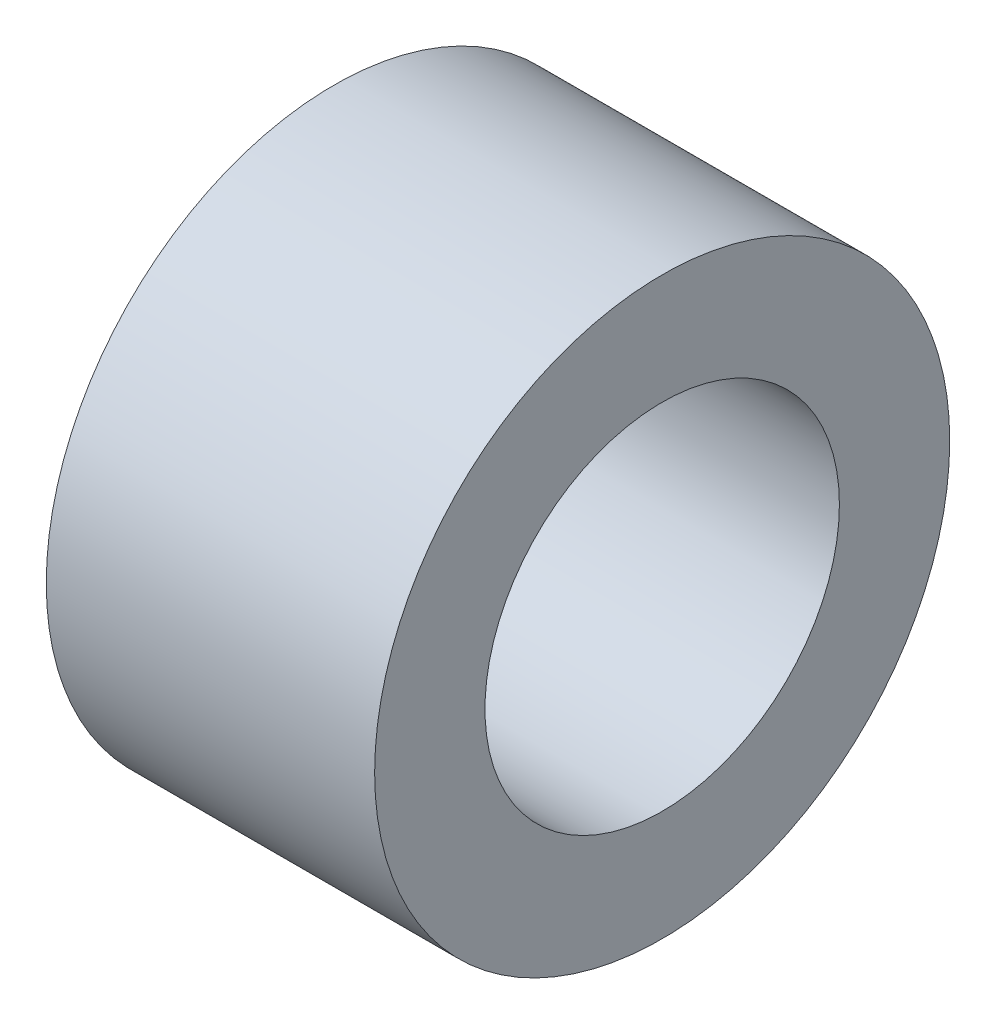
from build123d import *

# Parameters (mm, degrees)
SKETCH1_R           = 11.901099896
SKETCH1_R_2         = 10.2
BOSS_EXTRUDE1_DEPTH = 1.000000032
SKETCH2_R           = 16.55
SKETCH2_R_2         = 10.2
BOSS_EXTRUDE2_DEPTH = 18.900000046


with BuildPart() as part:
    # Sketch1 → Boss-Extrude1 (new body)
    with BuildSketch(Plane(origin=(0, 0, 0), x_dir=(0, 0, -1), z_dir=(1, 0, 0))):
        Circle(SKETCH1_R)
        Circle(SKETCH1_R_2, mode=Mode.SUBTRACT)
    extrude(amount=BOSS_EXTRUDE1_DEPTH)

    # Sketch2 → Boss-Extrude2 (add)
    with BuildSketch(Plane(origin=(1.000000032, 0, 0), x_dir=(0, 0, -1), z_dir=(1, 0, 0))):
        Circle(SKETCH2_R)
        Circle(SKETCH2_R_2, mode=Mode.SUBTRACT)
    extrude(amount=BOSS_EXTRUDE2_DEPTH)


solid = part.part
